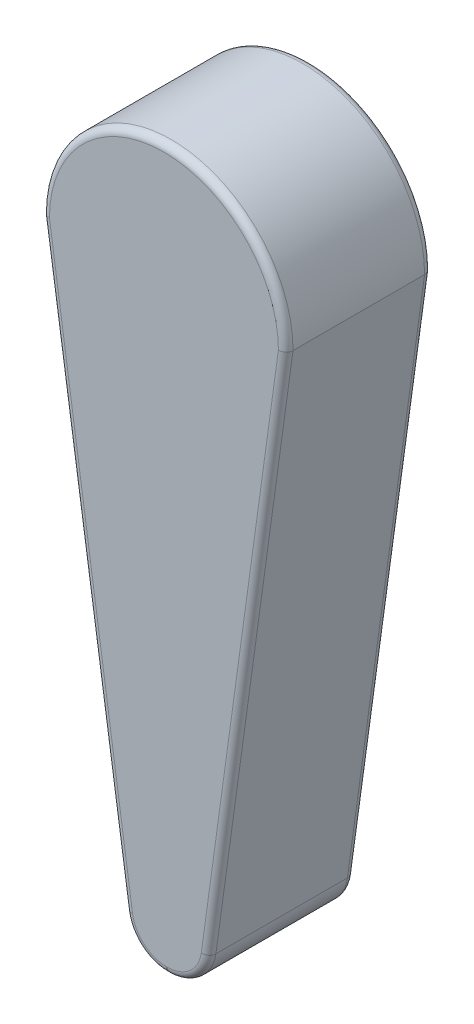
from build123d import *

# Parameters (mm, degrees)
BOSS_EXTRUDE1_DEPTH = 0.6
FILLET3_R           = 0.03
FILLET4_R           = 0.17
SCALE2_SCALE        = 10
SKETCH4_R           = 0.5334
SKETCH4_R_2         = 2
CUT_EXTRUDE5_DEPTH  = 1
SKETCH4_3_R         = 0.5334
SKETCH4_3_R_2       = 2
CUT_EXTRUDE6_DEPTH  = 0.5


with BuildPart() as part:
    # Sketch1 → Boss-Extrude1 (new body)
    with BuildSketch(Plane.XY):
        with BuildLine():
            Line((-0.136993219, -2.45), (0.163006781, -2.450375949))
            Line((0.163006781, -2.450375949), (0.499999859, -0.000375949))
            ThreePointArc((0.499999859, -0.000375949), (0.000187974, 0.499999965), (-0.5, 0))
            Line((-0.5, 0), (-0.136993219, -2.45))
        make_face()
    extrude(amount=BOSS_EXTRUDE1_DEPTH)

    # Fillet3
    fillet3_edges = [part.edges().sort_by_distance(p)[0] for p in [
        (0.33150332, -1.225375949, 0.6),
        (0.000187974, 0.499999965, 0.6),
        (-0.318496609, -1.225, 0.6),
        (0.000187974, 0.499999965, 0),
        (0.33150332, -1.225375949, 0),
        (0.013006781, -2.450187974, 0),
        (-0.318496609, -1.225, 0),
        (0.013006781, -2.450187974, 0.6),
    ]]
    fillet(fillet3_edges, radius=FILLET3_R)

    # Fillet4
    # the kernel refuses this fillet: 0.17 mm, written as the material it takes off along each edge
    with BuildSketch(Plane(origin=(0.009701663, -2.280183699, 0), x_dir=(-0.001253160871338018, -0.9999992147936071, 0), z_dir=(0.9999992147936071, -0.001253160871338018, 0))) as fillet4_piece_1:
        with BuildLine():
            CenterArc((0.14, -0.03), 0.03, 0, 90)
            Line((0.17, -0.03), (0.17, 0))
            Line((0.17, 0), (0.14, 0))
        make_face()
    revolve(axis=Axis((0.009701663, -2.280183699, 0), (0, 0, -1)), revolution_arc=81.500227405, mode=Mode.SUBTRACT)
    with BuildSketch(Plane(origin=(0.014814914, -2.280190107, 0), x_dir=(0.9906723955714478, -0.1362651997126514, 0), z_dir=(0.1362651997126514, 0.9906723955714478, 0))) as fillet4_piece_2:
        with BuildLine():
            CenterArc((0.14, -0.03), 0.03, 0, 90)
            Line((0.17, -0.03), (0.17, 0))
            Line((0.17, 0), (0.14, 0))
        make_face()
    revolve(axis=Axis((0.014814914, -2.280190107, 0), (0, 0, -1)), revolution_arc=82.240014231, mode=Mode.SUBTRACT)
    with BuildSketch(Plane(origin=(0.014814914, -2.280190107, 0.6), x_dir=(-0.001253160871338018, -0.9999992147936071, 0), z_dir=(-0.9999992147936071, 0.001253160871338018, 0))) as fillet4_piece_3:
        with BuildLine():
            CenterArc((0.14, -0.03), 0.03, 0, 90)
            Line((0.17, -0.03), (0.17, 0))
            Line((0.17, 0), (0.14, 0))
        make_face()
    revolve(axis=Axis((0.014814914, -2.280190107, 0.6), (0, 0, 1)), revolution_arc=82.240014231, mode=Mode.SUBTRACT)
    with BuildSketch(Plane(origin=(0.009701663, -2.280183699, 0.6), x_dir=(-0.9892008974747571, -0.14656597297850232, 0), z_dir=(-0.14656597297850232, 0.9892008974747571, 0))) as fillet4_piece_4:
        with BuildLine():
            CenterArc((0.14, -0.03), 0.03, 0, 90)
            Line((0.17, -0.03), (0.17, 0))
            Line((0.17, 0), (0.14, 0))
        make_face()
    revolve(axis=Axis((0.009701663, -2.280183699, 0.6), (0, 0, 1)), revolution_arc=81.500227405, mode=Mode.SUBTRACT)
    with BuildSketch(Plane(origin=(0.163006781, -2.450375949, 0), x_dir=(-0.999999214793607, 0.001253160871339251, 0), z_dir=(0, 0, 1))) as fillet4_piece_5:
        with BuildLine():
            CenterArc((FILLET4_R * 0.872970713312, -FILLET4_R), FILLET4_R, 90, 82.240014231)
            Line((-FILLET4_R * 0.117871666593, -FILLET4_R * 0.864976379166), (0, 0))
            Line((0, 0), (FILLET4_R * 0.872970713312, 0))
        make_face()
    extrude(amount=0.6, mode=Mode.SUBTRACT)
    with BuildSketch(Plane(origin=(-0.136993219, -2.45, 0), x_dir=(-0.14656597297850246, 0.9892008974747571, 0), z_dir=(0, 0, 1))) as fillet4_piece_6:
        with BuildLine():
            CenterArc((FILLET4_R * 0.861658584387, -FILLET4_R), FILLET4_R, 90, 81.500227405)
            Line((-FILLET4_R * 0.127357865618, -FILLET4_R * 0.852194514247), (0, 0))
            Line((0, 0), (FILLET4_R * 0.861658584387, 0))
        make_face()
    extrude(amount=0.6, mode=Mode.SUBTRACT)


with BuildPart() as part_1:
    # Scale2: scaled about (0.00425557, -0.756697726, 0.299999998)
    add(part.part.scale(SCALE2_SCALE).moved(Location((-0.03830013, 6.810279534, -2.699999982))))

    # Sketch4 → Cut-Extrude5 (cut)
    with BuildSketch(Plane(origin=(0, 0, -2.70000001), x_dir=(-1, 0, 0), z_dir=(0, 0, -1))):
        with Locations((0.041676609, 0.695226981)):
            Circle(SKETCH4_R)
        with Locations((0.042616275, -1.00657276)):
            Circle(SKETCH4_R)
        with Locations((0.04355594, -2.7083725)):
            Circle(SKETCH4_R)
        with Locations((0.044495606, -4.410172241)):
            Circle(SKETCH4_R)
        with Locations((0.045435271, -6.111971981)):
            Circle(SKETCH4_R)
        with Locations((0.046374936, -7.813771722)):
            Circle(SKETCH4_R)
        with Locations((0.038300124, 6.810276049)):
            Circle(SKETCH4_R_2)
    extrude(amount=-CUT_EXTRUDE5_DEPTH, mode=Mode.SUBTRACT)

    # Sketch4<3> → Cut-Extrude6 (cut)
    with BuildSketch(Plane(origin=(0, 0, -2.70000001), x_dir=(-1, 0, 0), z_dir=(0, 0, -1))):
        with BuildLine():
            Line((1.792330148, -7.279407594), (2.852562233, 4.61584025))
            ThreePointArc((2.852562233, 4.61584025), (0.036329632, 10.378975505), (-2.77353691, 4.612733744))
            Line((-2.77353691, 4.612733744), (-1.700169319, -7.281336012))
            ThreePointArc((-1.700169319, -7.281336012), (0.047044623, -9.026621537), (1.792330148, -7.279407594))
        make_face()
        with Locations((0.041676609, 0.695226981)):
            Circle(SKETCH4_3_R, mode=Mode.SUBTRACT)
        with Locations((0.042616275, -1.00657276)):
            Circle(SKETCH4_3_R, mode=Mode.SUBTRACT)
        with Locations((0.04355594, -2.7083725)):
            Circle(SKETCH4_3_R, mode=Mode.SUBTRACT)
        with Locations((0.044495606, -4.410172241)):
            Circle(SKETCH4_3_R, mode=Mode.SUBTRACT)
        with Locations((0.045435271, -6.111971981)):
            Circle(SKETCH4_3_R, mode=Mode.SUBTRACT)
        with Locations((0.046374936, -7.813771722)):
            Circle(SKETCH4_3_R, mode=Mode.SUBTRACT)
        with Locations((0.038300124, 6.810276049)):
            Circle(SKETCH4_3_R_2, mode=Mode.SUBTRACT)
    extrude(amount=-CUT_EXTRUDE6_DEPTH, mode=Mode.SUBTRACT)


solid = part_1.part
